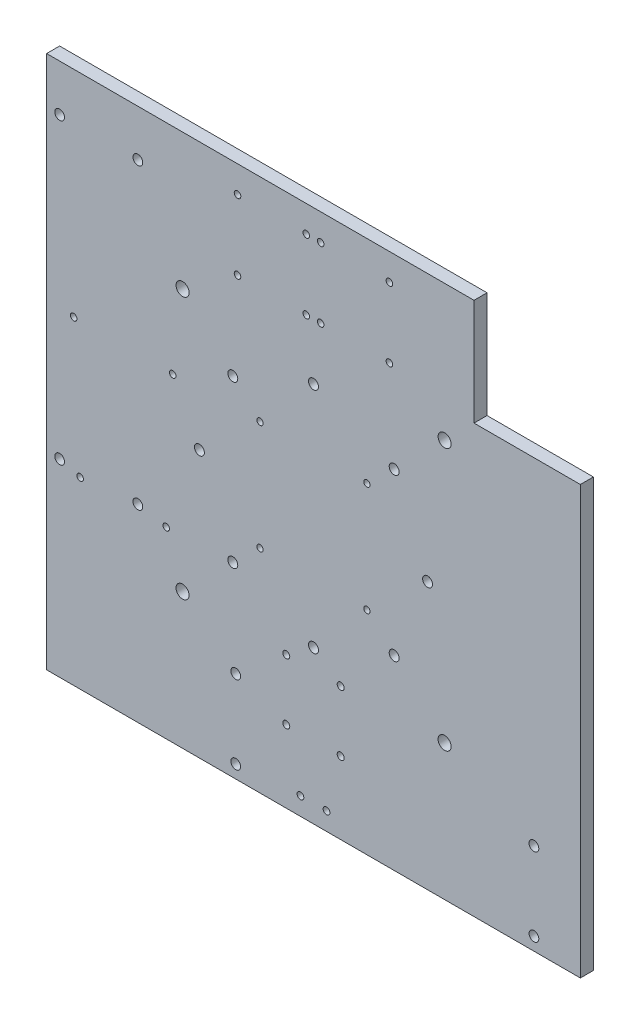
from build123d import *

# Parameters (mm, degrees)
SKETCH1_W           = 260
SKETCH1_H           = 260
SKETCH1_R           = 1.55
SKETCH1_R_2         = 1.5875
SKETCH1_R_3         = 1.6
SKETCH1_R_4         = 1.7
SKETCH1_R_5         = 2.415
SKETCH1_R_6         = 1.651
BOSS_EXTRUDE2_DEPTH = 6.35
SKETCH5_W           = 52.8
SKETCH5_H           = 52.8
CUT_EXTRUDE1_DEPTH  = 184.957393165
SKETCH6_R           = 3.175
CUT_EXTRUDE2_DEPTH  = 184.957393165
SKETCH7_R           = 2.38125
CUT_EXTRUDE3_DEPTH  = 184.957393165


with BuildPart() as part:
    # Sketch1 → Boss-Extrude2 (new body)
    with BuildSketch(Plane.XY):
        Rectangle(SKETCH1_W, SKETCH1_H)
        with Locations((-26.035, 26.67)):
            Circle(SKETCH1_R, mode=Mode.SUBTRACT)
        with Locations((-26.035, -26.67)):
            Circle(SKETCH1_R, mode=Mode.SUBTRACT)
        with Locations((26.035, 26.67)):
            Circle(SKETCH1_R, mode=Mode.SUBTRACT)
        with Locations((26.035, -26.67)):
            Circle(SKETCH1_R, mode=Mode.SUBTRACT)
        with Locations((-116.825, 25.402702903)):
            Circle(SKETCH1_R_2, mode=Mode.SUBTRACT)
        with Locations((-113.65, -40.635194695)):
            Circle(SKETCH1_R_2, mode=Mode.SUBTRACT)
        with Locations((-68.565, 25.404805305)):
            Circle(SKETCH1_R_2, mode=Mode.SUBTRACT)
        with Locations((-37, 117)):
            Circle(SKETCH1_R_3, mode=Mode.SUBTRACT)
        with Locations((-37, 83)):
            Circle(SKETCH1_R_3, mode=Mode.SUBTRACT)
        with Locations((-3.5, 117)):
            Circle(SKETCH1_R_3, mode=Mode.SUBTRACT)
        with Locations((-3.5, 83)):
            Circle(SKETCH1_R_3, mode=Mode.SUBTRACT)
        with Locations((3.5, 117)):
            Circle(SKETCH1_R_3, mode=Mode.SUBTRACT)
        with Locations((37, 117)):
            Circle(SKETCH1_R_3, mode=Mode.SUBTRACT)
        with Locations((37, 83)):
            Circle(SKETCH1_R_3, mode=Mode.SUBTRACT)
        with Locations((3.5, 83)):
            Circle(SKETCH1_R_3, mode=Mode.SUBTRACT)
        with Locations((-13.25, -65.25)):
            Circle(SKETCH1_R_4, mode=Mode.SUBTRACT)
        with Locations((13.25, -65.25)):
            Circle(SKETCH1_R_4, mode=Mode.SUBTRACT)
        with Locations((13.25, -94.75)):
            Circle(SKETCH1_R_4, mode=Mode.SUBTRACT)
        with Locations((-13.25, -94.75)):
            Circle(SKETCH1_R_4, mode=Mode.SUBTRACT)
        with Locations((0, 55.575)):
            Circle(SKETCH1_R_5, mode=Mode.SUBTRACT)
        with Locations((-55.575, 0)):
            Circle(SKETCH1_R_5, mode=Mode.SUBTRACT)
        with Locations((0, -55.575)):
            Circle(SKETCH1_R_5, mode=Mode.SUBTRACT)
        with Locations((55.575, 0)):
            Circle(SKETCH1_R_5, mode=Mode.SUBTRACT)
        with Locations((-39.297459364, 39.297459364)):
            Circle(SKETCH1_R_5, mode=Mode.SUBTRACT)
        with Locations((39.297459364, 39.297459364)):
            Circle(SKETCH1_R_5, mode=Mode.SUBTRACT)
        with Locations((39.297459364, -39.297459364)):
            Circle(SKETCH1_R_5, mode=Mode.SUBTRACT)
        with Locations((-39.297459364, -39.297459364)):
            Circle(SKETCH1_R_5, mode=Mode.SUBTRACT)
        with Locations((-71.74, -40.635194695)):
            Circle(SKETCH1_R_2, mode=Mode.SUBTRACT)
        with Locations((6.35, -121.3)):
            Circle(SKETCH1_R_6, mode=Mode.SUBTRACT)
        with Locations((-6.35, -121.3)):
            Circle(SKETCH1_R_6, mode=Mode.SUBTRACT)
        with Locations((121.3, 126.35)):
            Circle(SKETCH1_R_6, mode=Mode.SUBTRACT)
        with Locations((121.3, 113.65)):
            Circle(SKETCH1_R_6, mode=Mode.SUBTRACT)
    extrude(amount=BOSS_EXTRUDE2_DEPTH)

    # Sketch5 → Cut-Extrude1 (cut, through all)
    with BuildSketch(Plane(origin=(0, 0, 0), x_dir=(-1, 0, 0), z_dir=(0, 0, -1))):
        with Locations((-104.6, 104.6)):
            Rectangle(SKETCH5_W, SKETCH5_H)
    extrude(amount=-CUT_EXTRUDE1_DEPTH, mode=Mode.SUBTRACT)

    # Sketch6 → Cut-Extrude2 (cut, through all)
    with BuildSketch(Plane(origin=(0, 0, 0), x_dir=(-1, 0, 0), z_dir=(0, 0, -1))):
        with Locations((63.77864005, 63.77864005)):
            Circle(SKETCH6_R)
        with Locations((-63.87464005, 63.77864005)):
            Circle(SKETCH6_R)
        with Locations((-63.87464005, -63.87464005)):
            Circle(SKETCH6_R)
        with Locations((63.77864005, -63.87464005)):
            Circle(SKETCH6_R)
    extrude(amount=-CUT_EXTRUDE2_DEPTH, mode=Mode.SUBTRACT)

    # Sketch7 → Cut-Extrude3 (cut, through all)
    with BuildSketch(Plane(origin=(0, 0, 0), x_dir=(-1, 0, 0), z_dir=(0, 0, -1))):
        with Locations((85.55, -37.878125)):
            Circle(SKETCH7_R)
        with Locations((123.65, -37.878125)):
            Circle(SKETCH7_R)
        with Locations((123.65, 107.378125)):
            Circle(SKETCH7_R)
        with Locations((85.55, 107.378125)):
            Circle(SKETCH7_R)
        with Locations((37.878125, -123.65)):
            Circle(SKETCH7_R)
        with Locations((37.878125, -85.55)):
            Circle(SKETCH7_R)
        with Locations((-107.378125, -123.65)):
            Circle(SKETCH7_R)
        with Locations((-107.378125, -85.55)):
            Circle(SKETCH7_R)
    extrude(amount=-CUT_EXTRUDE3_DEPTH, mode=Mode.SUBTRACT)


solid = part.part
